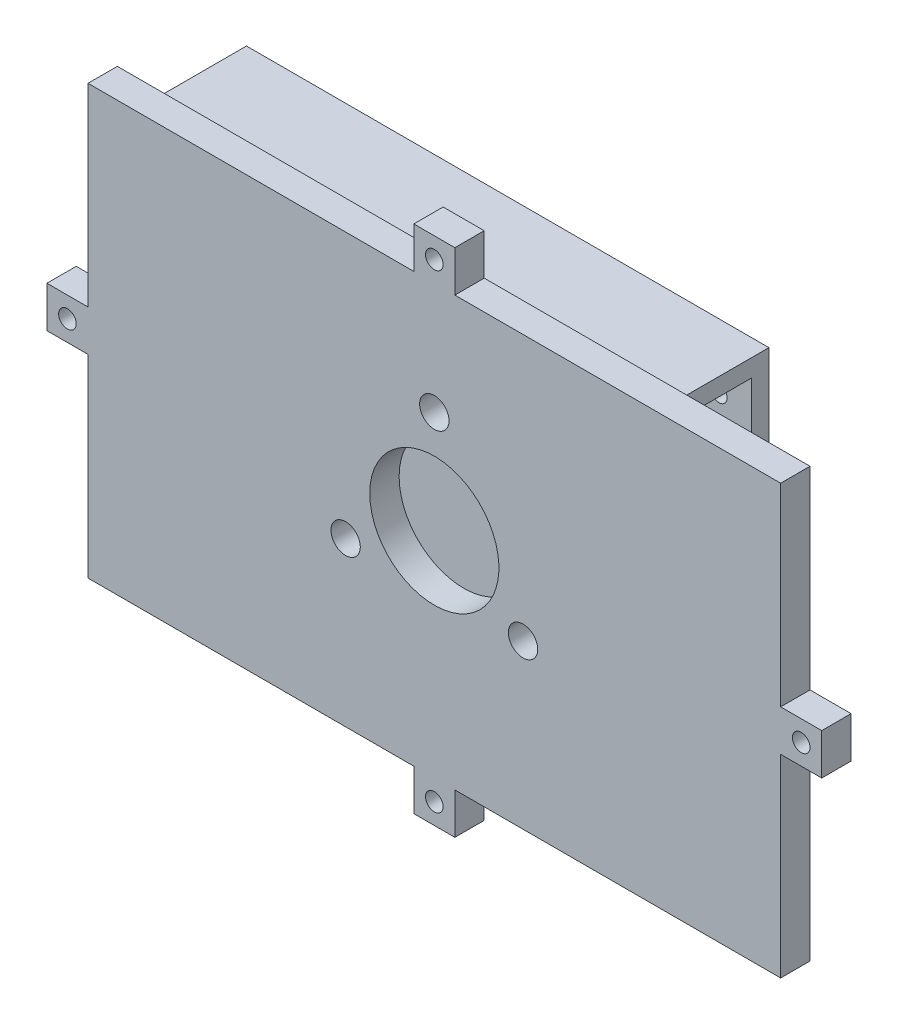
from build123d import *

# Parameters (mm, degrees)
CROQUIS1_R                  = 1.5
SALIENTE_EXTRUIR1_DEPTH     = 5
CROQUIS3_R                  = 11
CROQUIS3_R_2                = 2.5
CORTAR_EXTRUIR1_DEPTH       = 10
CROQUIS4_W                  = 89
CROQUIS4_H                  = 65
CROQUIS4_W_2                = 83
CROQUIS4_H_2                = 59
SALIENTE_EXTRUIR3_DEPTH     = 18
CROQUIS5_W                  = 83
CROQUIS5_H                  = 59
CROQUIS5_R                  = 1.375
SALIENTE_EXTRUIR4_DEPTH     = 3
SALIENTE_EXTRUIR5_START     = -89
SALIENTE_EXTRUIR5_OUTLINE_W = 15
SALIENTE_EXTRUIR5_OUTLINE_H = 59
SALIENTE_EXTRUIR5_DEPTH     = 89


# Read off the part's stored shape, not the designer's step: Saliente-Extruir5
with BuildPart() as part:
    # Croquis1 → Saliente-Extruir1 (new body)
    with BuildSketch(Plane.XY):
        Polygon((-40.689655172, 34.755747126), (14.810344828, 34.755747126), (14.810344828, 41.755747126), (21.810344828, 41.755747126), (21.810344828, 34.755747126), (77.310344828, 34.755747126), (77.310344828, 1.755747126), (84.310344828, 1.755747126), (84.310344828, -5.244252874), (77.310344828, -5.244252874), (77.310344828, -38.244252874), (21.810344828, -38.244252874), (21.810344828, -45.244252874), (14.810344828, -45.244252874), (14.810344828, -38.244252874), (-40.689655172, -38.244252874), (-40.689655172, -5.244252874), (-47.689655172, -5.244252874), (-47.689655172, 1.755747126), (-40.689655172, 1.755747126), align=None)
        with Locations((18.310344828, 38.255747126)):
            Circle(CROQUIS1_R, mode=Mode.SUBTRACT)
        with Locations((-44.189655172, -1.744252874)):
            Circle(CROQUIS1_R, mode=Mode.SUBTRACT)
        with Locations((80.810344828, -1.744252874)):
            Circle(CROQUIS1_R, mode=Mode.SUBTRACT)
        with Locations((18.310344828, -41.744252874)):
            Circle(CROQUIS1_R, mode=Mode.SUBTRACT)
    extrude(amount=-SALIENTE_EXTRUIR1_DEPTH)

    # Croquis3 → Cortar-Extruir1 (cut)
    with BuildSketch(Plane(origin=(0, 0, -5), x_dir=(-1, 0, 0), z_dir=(0, 0, -1))):
        with Locations((-18.310344828, -1.744252874)):
            Circle(CROQUIS3_R)
        with Locations((-18.310344828, 15.700747126)):
            Circle(CROQUIS3_R_2)
        with Locations((-3.198201532, -10.469252874)):
            Circle(CROQUIS3_R_2)
        with Locations((-33.422488124, -10.469252874)):
            Circle(CROQUIS3_R_2)
    extrude(amount=-CORTAR_EXTRUIR1_DEPTH, mode=Mode.SUBTRACT)

    # Croquis4 → Saliente-Extruir3 (add)
    with BuildSketch(Plane(origin=(0, 0, -5), x_dir=(-1, 0, 0), z_dir=(0, 0, -1))):
        with Locations((-7.810344828, -1.744252874)):
            Rectangle(CROQUIS4_W, CROQUIS4_H)
        with Locations((-7.810344828, -1.744252874)):
            Rectangle(CROQUIS4_W_2, CROQUIS4_H_2, mode=Mode.SUBTRACT)
    extrude(amount=SALIENTE_EXTRUIR3_DEPTH)

    # Croquis5 → Saliente-Extruir4 (add)
    with BuildSketch(Plane(origin=(0, 0, -23), x_dir=(-1, 0, 0), z_dir=(0, 0, -1))):
        with Locations((-7.810344828, -1.744252874)):
            Rectangle(CROQUIS5_W, CROQUIS5_H)
        with Locations((-46.810344828, 22.755747126)):
            Circle(CROQUIS5_R, mode=Mode.SUBTRACT)
        with Locations((-46.810344828, -26.244252874)):
            Circle(CROQUIS5_R, mode=Mode.SUBTRACT)
        with Locations((17.312228898, 22.755747126)):
            Circle(CROQUIS5_R, mode=Mode.SUBTRACT)
        with Locations((18.687228898, -26.244252874)):
            Circle(CROQUIS5_R, mode=Mode.SUBTRACT)
    extrude(amount=-SALIENTE_EXTRUIR4_DEPTH)

    # Saliente-Extruir5 outline → Saliente-Extruir5 (cut)
    with BuildSketch(Plane(origin=(52.310344828, 0, 0), x_dir=(0, 0, -1), z_dir=(1, 0, 0)).offset(SALIENTE_EXTRUIR5_START)):
        with Locations((12.5, -1.744252874)):
            Rectangle(SALIENTE_EXTRUIR5_OUTLINE_W, SALIENTE_EXTRUIR5_OUTLINE_H)
    extrude(amount=SALIENTE_EXTRUIR5_DEPTH, mode=Mode.SUBTRACT)


solid = part.part
